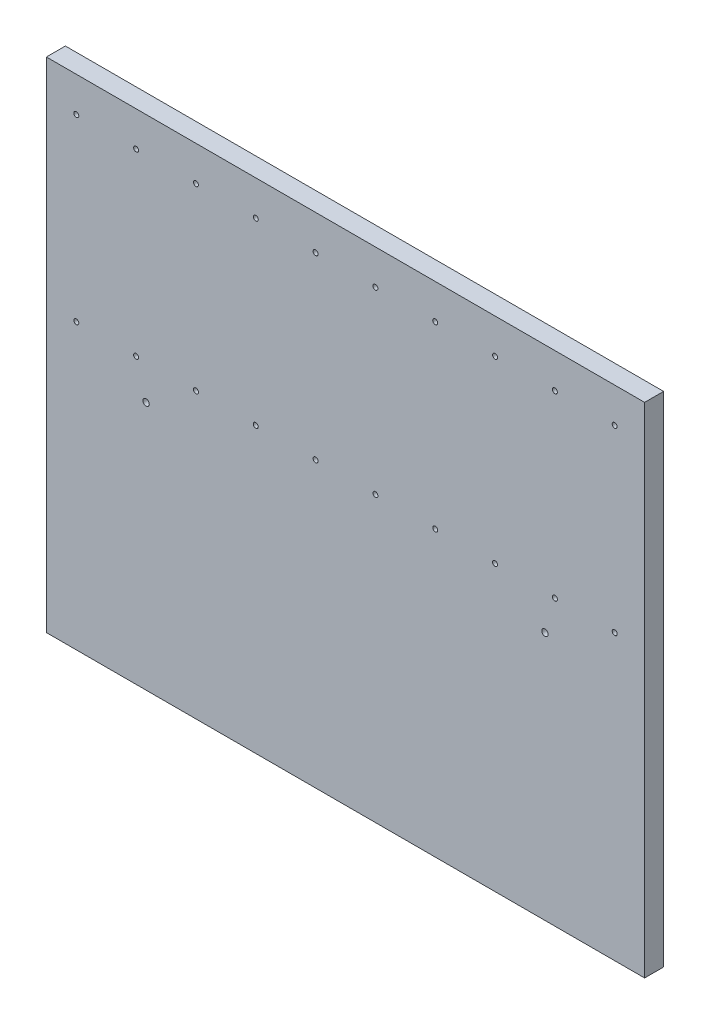
from build123d import *

# Parameters (mm, degrees)
BOSS_EXTRUDE1_DEPTH = 19.05
SKETCH2_R           = 2.5
CUT_EXTRUDE1_DEPTH  = 5
SKETCH3_R           = 3.175
CUT_EXTRUDE2_DEPTH  = 391.976856732


with BuildPart() as part:
    # Sketch1 → Boss-Extrude1 (new body)
    with BuildSketch(Plane.XY):
        Polygon((300, 185), (300, 250), (-300, 250), (-300, -250), (300, -250), align=None)
    extrude(amount=BOSS_EXTRUDE1_DEPTH)

    # Sketch2 → Cut-Extrude1 (cut)
    with BuildSketch(Plane.XY.offset(19.05)):
        with Locations((270, 35)):
            Circle(SKETCH2_R)
        with Locations((210, 35)):
            Circle(SKETCH2_R)
        with Locations((150, 35)):
            Circle(SKETCH2_R)
        with Locations((90, 35)):
            Circle(SKETCH2_R)
        with Locations((30, 35)):
            Circle(SKETCH2_R)
        with Locations((-30, 35)):
            Circle(SKETCH2_R)
        with Locations((-90, 35)):
            Circle(SKETCH2_R)
        with Locations((-150, 35)):
            Circle(SKETCH2_R)
        with Locations((-210, 35)):
            Circle(SKETCH2_R)
        with Locations((-270, 35)):
            Circle(SKETCH2_R)
        with Locations((-270, 215)):
            Circle(SKETCH2_R)
        with Locations((-210, 215)):
            Circle(SKETCH2_R)
        with Locations((-150, 215)):
            Circle(SKETCH2_R)
        with Locations((-90, 215)):
            Circle(SKETCH2_R)
        with Locations((-30, 215)):
            Circle(SKETCH2_R)
        with Locations((30, 215)):
            Circle(SKETCH2_R)
        with Locations((90, 215)):
            Circle(SKETCH2_R)
        with Locations((150, 215)):
            Circle(SKETCH2_R)
        with Locations((210, 215)):
            Circle(SKETCH2_R)
        with Locations((270, 215)):
            Circle(SKETCH2_R)
    extrude(amount=-CUT_EXTRUDE1_DEPTH, mode=Mode.SUBTRACT)

    # Sketch3 → Cut-Extrude2 (cut, through all)
    with BuildSketch(Plane.XY.offset(19.05)):
        with Locations((-200, 0)):
            Circle(SKETCH3_R)
        with Locations((200, 0)):
            Circle(SKETCH3_R)
    extrude(amount=-CUT_EXTRUDE2_DEPTH, mode=Mode.SUBTRACT)


solid = part.part
